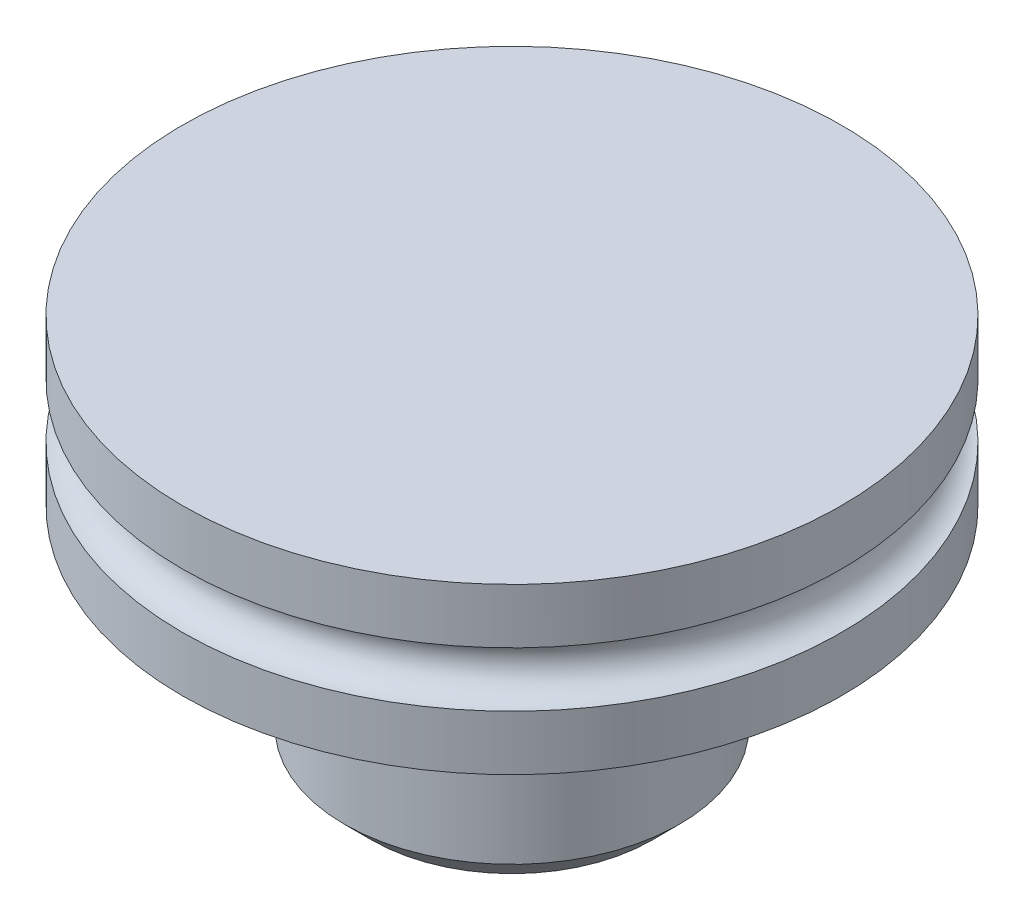
from build123d import *

# Parameters (mm, degrees)
SKETCH1_R           = 3.05
BOSS_EXTRUDE1_DEPTH = 3
SKETCH4_R           = 3.6
BOSS_EXTRUDE3_DEPTH = 1
SKETCH2_R           = 6
BOSS_EXTRUDE2_DEPTH = 3
SKETCH3_R           = 0.5
CHAMFER1_SIZE       = 0.5


with BuildPart() as part:
    # Sketch1 → Boss-Extrude1 (new body)
    with BuildSketch(Plane(origin=(0, 0, 0), x_dir=(1, 0, 0), z_dir=(0, 1, 0))):
        Circle(SKETCH1_R)
    extrude(amount=BOSS_EXTRUDE1_DEPTH)

    # Sketch4 → Boss-Extrude3 (add)
    with BuildSketch(Plane(origin=(0, 3, 0), x_dir=(1, 0, 0), z_dir=(0, 1, 0))):
        Circle(SKETCH4_R)
    extrude(amount=BOSS_EXTRUDE3_DEPTH)

    # Sketch2 → Boss-Extrude2 (add)
    with BuildSketch(Plane(origin=(0, 4, 0), x_dir=(1, 0, 0), z_dir=(0, 1, 0))):
        Circle(SKETCH2_R)
    extrude(amount=BOSS_EXTRUDE2_DEPTH)

    # Sketch3 → Cut-Revolve1 (revolve, cut)
    with BuildSketch(Plane.XY):
        with Locations((-6, 5.5)):
            Circle(SKETCH3_R)
    revolve(axis=Axis((0, 9.115200414, 0), (0, -1, 0)), mode=Mode.SUBTRACT)

    # Chamfer1
    chamfer1_edges = [part.edges().sort_by_distance(p)[0] for p in [
        (-3.05, 0, 0),
    ]]
    chamfer(chamfer1_edges, length=CHAMFER1_SIZE)


solid = part.part
